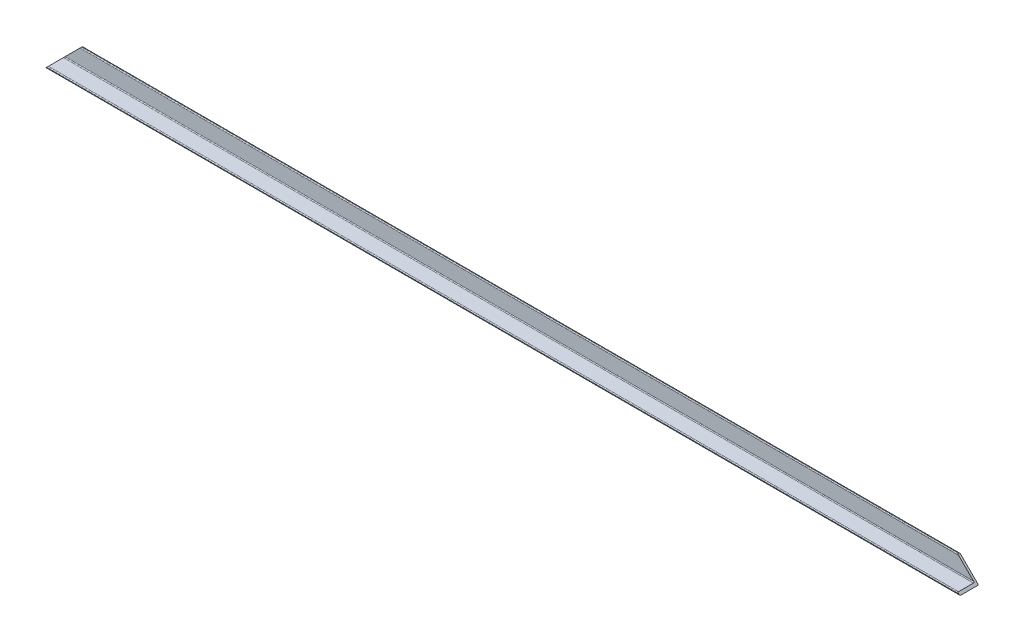
from build123d import *

# Parameters (mm, degrees)
SKETCH1_W               = 1115
SKETCH1_H               = 22.5
BOSS_EXTRUDE1_DEPTH     = 2.5
SKETCH2_W               = 1115
SKETCH2_H               = 2.5
BOSS_EXTRUDE2_DEPTH     = 20
CUT_EXTRUDE1_DEPTH      = 559.312188654
CUT_EXTRUDE1_DEPTH_BACK = 25
FILLET2_R               = 1


with BuildPart() as part:
    # Sketch1 → Boss-Extrude1 (new body)
    with BuildSketch(Plane(origin=(0, 0, 0), x_dir=(1, 0, 0), z_dir=(0, 1, 0))):
        Rectangle(SKETCH1_W, SKETCH1_H)
    extrude(amount=BOSS_EXTRUDE1_DEPTH)

    # Sketch2 → Boss-Extrude2 (add)
    with BuildSketch(Plane(origin=(0, 2.5, 0), x_dir=(1, 0, 0), z_dir=(0, 1, 0))):
        with Locations((0, 10)):
            Rectangle(SKETCH2_W, SKETCH2_H)
    extrude(amount=BOSS_EXTRUDE2_DEPTH)

    # Sketch3 → Cut-Extrude1 (cut, two sides: drawn at the far end of the back side and taken through both)
    with BuildSketch(Plane.XY.offset(-8.75).offset(-CUT_EXTRUDE1_DEPTH_BACK)):
        Polygon((-557.5, 22.5), (-557.5, -7.5), (-527.5, 22.5), align=None)
        Polygon((557.5, 22.5), (557.5, -7.5), (527.5, 22.5), align=None)
    extrude(amount=CUT_EXTRUDE1_DEPTH + CUT_EXTRUDE1_DEPTH_BACK, mode=Mode.SUBTRACT)

    # Fillet2
    fillet2_edges = [part.edges().sort_by_distance(p)[0] for p in [
        (0, 0, -11.25),
        (0, 0, 11.25),
        (0, 2.5, 11.25),
        (0, 22.5, -11.25),
        (0, 22.5, -8.75),
        (0, 2.5, -8.75),
    ]]
    fillet(fillet2_edges, radius=FILLET2_R)


solid = part.part
